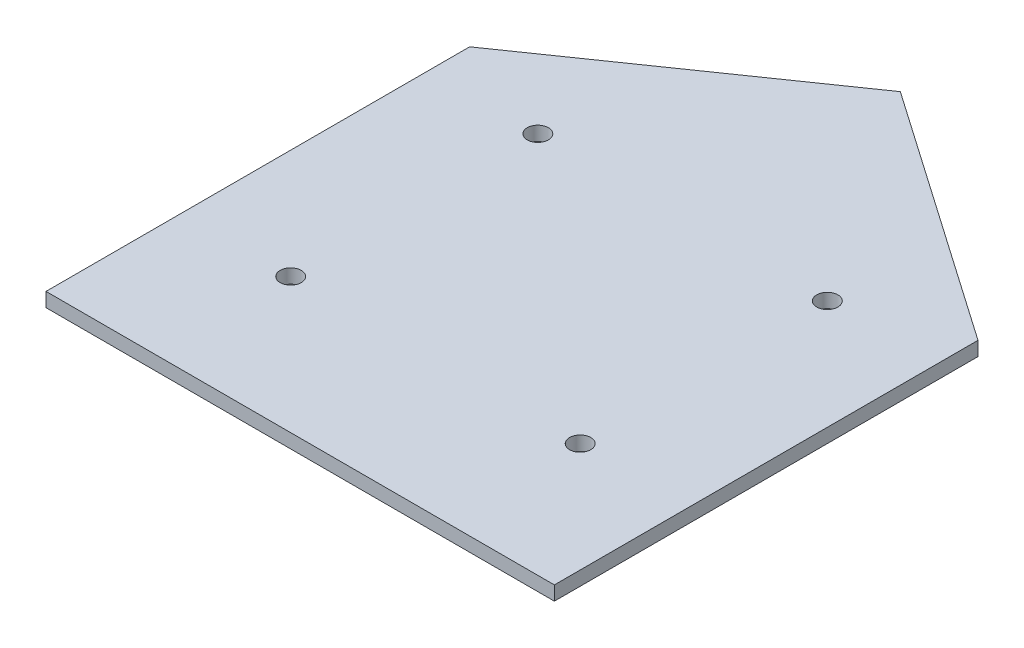
from build123d import *

# Parameters (mm, degrees)
SKETCH1_R           = 1.5
BOSS_EXTRUDE1_DEPTH = 2


with BuildPart() as part:
    # Sketch1 → Boss-Extrude1 (new body)
    with BuildSketch(Plane(origin=(0, 0, 0), x_dir=(1, 0, 0), z_dir=(0, 1, 0))):
        Polygon((-36, -30), (-36, 30), (0, 55), (36, 30), (36, -30), align=None)
        with Locations((-20.5, 24.157329938)):
            Circle(SKETCH1_R, mode=Mode.SUBTRACT)
        with Locations((20.5, 24.157329938)):
            Circle(SKETCH1_R, mode=Mode.SUBTRACT)
        with Locations((20.5, -10.842670062)):
            Circle(SKETCH1_R, mode=Mode.SUBTRACT)
        with Locations((-20.5, -10.842670062)):
            Circle(SKETCH1_R, mode=Mode.SUBTRACT)
    extrude(amount=BOSS_EXTRUDE1_DEPTH)


solid = part.part
